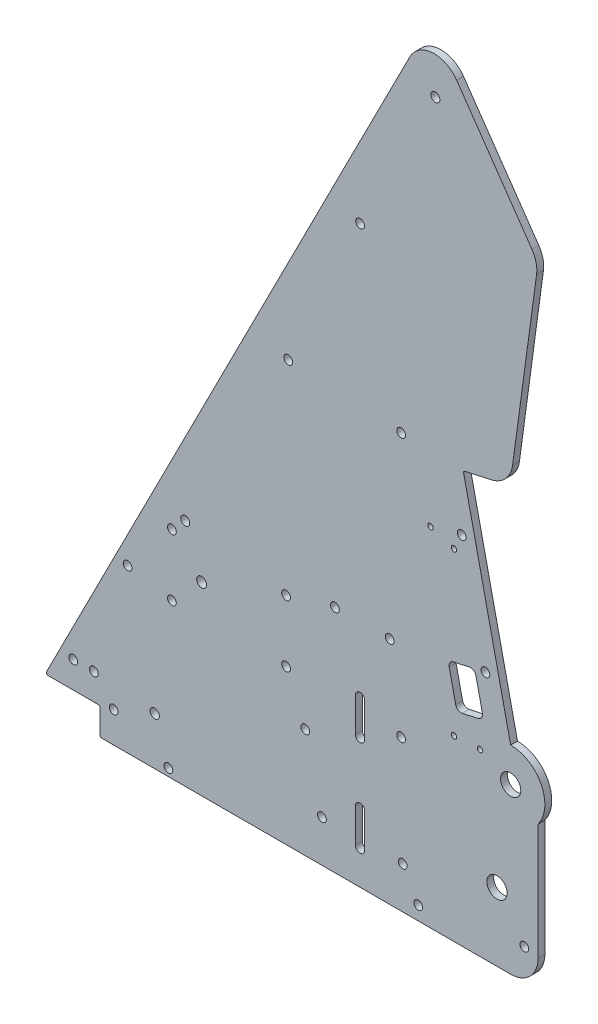
from build123d import *

# Parameters (mm, degrees)
BOSS_EXTRUDE1_DEPTH     = 3.175
SKETCH2_R               = 2.0955
SKETCH2_R_2             = 2.286
SKETCH2_R_3             = 2.032
SKETCH2_R_4             = 4.699
CUT_EXTRUDE1_DEPTH      = 421.976111717
SKETCH7_R               = 2.159
CUT_EXTRUDE2_DEPTH      = 421.976111717
CUT_EXTRUDE3_REACH      = 422.976
SKETCH10_R              = 2.032
FILLET1_R               = 12.7
FILLET2_R               = 0.79375
SKETCH12_R              = 2.032
CUT_EXTRUDE5_DEPTH      = 411.989226146
SKETCH13_R              = 2.032
CUT_EXTRUDE6_DEPTH      = 411.989226146
CUT_EXTRUDE7_DEPTH      = 411.989226146
CUT_EXTRUDE7_DEPTH_BACK = 411.989226146
SKETCH14_R              = 1.27
SKETCH14_R_2            = 2.032
FILLET3_R               = 2.54


with BuildPart() as part:
    # Sketch1 → Boss-Extrude1 (new body)
    with BuildSketch(Plane.XY):
        with BuildLine():
            Line((228.6, -12.7), (228.6, 53.975))
            ThreePointArc((228.6, 53.975), (230.099031657, 70.599515829), (215.9, 79.375))
            Line((215.9, 79.375), (193.909735224, 178.566674323))
            Line((193.909735224, 178.566674323), (215.607913982, 183.377044743))
            Line((215.607913982, 183.377044743), (228.6, 279.4))
            Line((228.6, 279.4), (178.754725958, 351.413083686))
            Line((178.754725958, 351.413083686), (0, 0))
            Line((0, 0), (25.4, 0))
            Line((25.4, 0), (25.4, -12.7))
            Line((25.4, -12.7), (228.6, -12.7))
        make_face()
    extrude(amount=BOSS_EXTRUDE1_DEPTH)

    # Sketch2 → Cut-Extrude1 (cut, through all)
    with BuildSketch(Plane.XY.offset(3.175)):
        with Locations((64.943150167, 94.057839899)):
            Circle(SKETCH2_R)
        with Locations((180.975, 322.164313376)):
            Circle(SKETCH2_R)
        with Locations((72.544547852, 73.173171402)):
            Circle(SKETCH2_R_2)
        with Locations((193.207821773, 152.394364194)):
            Circle(SKETCH2_R_3)
        with Locations((215.9, 63.5)):
            Circle(SKETCH2_R_4)
        with Locations((173.0375, -6.35)):
            Circle(SKETCH2_R_3)
        with Locations((204.202954161, 102.798527032)):
            Circle(SKETCH2_R_3)
        with Locations((209.55, 19.05)):
            Circle(SKETCH2_R_4)
        with Locations((165.1, 179.3875)):
            Circle(SKETCH2_R_3)
        with Locations((111.724047852, 87.460671402)):
            Circle(SKETCH2_R_3)
        with Locations((111.724047852, 58.885671402)):
            Circle(SKETCH2_R_3)
        with Locations((58.765047852, 58.885671402)):
            Circle(SKETCH2_R_3)
        with Locations((58.765047852, 87.460671402)):
            Circle(SKETCH2_R_3)
    extrude(amount=-CUT_EXTRUDE1_DEPTH, mode=Mode.SUBTRACT)

    # Sketch7 → Cut-Extrude2 (cut, through all)
    with BuildSketch(Plane.XY.offset(3.175)):
        with Locations((50.8, 9.525)):
            Circle(SKETCH7_R)
        with BuildLine():
            Line((143.891, 3.175), (143.891, 19.05))
            ThreePointArc((143.891, 19.05), (146.05, 21.209), (148.209, 19.05))
            Line((148.209, 19.05), (148.209, 3.175))
            ThreePointArc((148.209, 3.175), (146.05, 1.016), (143.891, 3.175))
        make_face()
        with BuildLine():
            Line((143.891, 47.625), (143.891, 63.5))
            ThreePointArc((143.891, 63.5), (146.05, 65.659), (148.209, 63.5))
            Line((148.209, 63.5), (148.209, 47.625))
            ThreePointArc((148.209, 47.625), (146.05, 45.466), (143.891, 47.625))
        make_face()
    extrude(amount=-CUT_EXTRUDE2_DEPTH, mode=Mode.SUBTRACT)

    # Sketch10 → Cut-Extrude3 (cut, up to next)
    with BuildSketch(Plane.XY.offset(3.175), mode=Mode.PRIVATE) as cut_extrude3_sk1:
        with Locations((120.65, 38.1)):
            Circle(SKETCH10_R)
    cut_extrude3_tool1 = extrude(cut_extrude3_sk1.sketch, amount=-CUT_EXTRUDE3_REACH, mode=Mode.PRIVATE) & part.part
    # Sketch10 → Cut-Extrude3 (cut, up to next)
    with BuildSketch(Plane.XY.offset(3.175), mode=Mode.PRIVATE) as cut_extrude3_sk2:
        with Locations((165.1, 57.15)):
            Circle(SKETCH10_R)
    cut_extrude3_tool2 = extrude(cut_extrude3_sk2.sketch, amount=-CUT_EXTRUDE3_REACH, mode=Mode.PRIVATE) & part.part
    # Sketch10 → Cut-Extrude3 (cut, up to next)
    with BuildSketch(Plane.XY.offset(3.175), mode=Mode.PRIVATE) as cut_extrude3_sk3:
        with Locations((13.046467246, 12.334704411)):
            Circle(SKETCH10_R)
    cut_extrude3_tool3 = extrude(cut_extrude3_sk3.sketch, amount=-CUT_EXTRUDE3_REACH, mode=Mode.PRIVATE) & part.part
    # Sketch10 → Cut-Extrude3 (cut, up to next)
    with BuildSketch(Plane.XY.offset(3.175), mode=Mode.PRIVATE) as cut_extrude3_sk4:
        with Locations((22.571467246, 12.334704411)):
            Circle(SKETCH10_R)
    cut_extrude3_tool4 = extrude(cut_extrude3_sk4.sketch, amount=-CUT_EXTRUDE3_REACH, mode=Mode.PRIVATE) & part.part
    # Sketch10 → Cut-Extrude3 (cut, up to next)
    with BuildSketch(Plane.XY.offset(3.175), mode=Mode.PRIVATE) as cut_extrude3_sk5:
        with Locations((38.211447917, 62.639810909)):
            Circle(SKETCH10_R)
    cut_extrude3_tool5 = extrude(cut_extrude3_sk5.sketch, amount=-CUT_EXTRUDE3_REACH, mode=Mode.PRIVATE) & part.part
    add(cut_extrude3_tool1.solids().sort_by_distance((120.65, 38.1, 3.175))[0], mode=Mode.SUBTRACT)
    add(cut_extrude3_tool2.solids().sort_by_distance((165.1, 57.15, 3.175))[0], mode=Mode.SUBTRACT)
    add(cut_extrude3_tool3.solids().sort_by_distance((13.046467, 12.334704, 3.175))[0], mode=Mode.SUBTRACT)
    add(cut_extrude3_tool4.solids().sort_by_distance((22.571467, 12.334704, 3.175))[0], mode=Mode.SUBTRACT)
    add(cut_extrude3_tool5.solids().sort_by_distance((38.211448, 62.639811, 3.175))[0], mode=Mode.SUBTRACT)

    # Fillet1
    fillet1_edges = [part.edges().sort_by_distance(p)[0] for p in [
        (228.6, -12.7, 1.5875),
        (178.754725958, 351.413083686, 1.5875),
        (215.607913982, 183.377044743, 1.5875),
        (228.6, 279.4, 1.5875),
    ]]
    fillet(fillet1_edges, radius=FILLET1_R)

    # Fillet2
    fillet2_edges = [part.edges().sort_by_distance(p)[0] for p in [
        (25.4, -12.7, 1.5875),
        (25.4, 0, 1.5875),
        (193.909735224, 178.566674323, 1.5875),
        (0, 0, 1.5875),
    ]]
    fillet(fillet2_edges, radius=FILLET2_R)

    # Sketch12 → Cut-Extrude5 (cut, through all)
    with BuildSketch(Plane.XY.offset(3.175)):
        with Locations((31.75, 1.5875)):
            Circle(SKETCH12_R)
        with Locations((173.0375, -6.35)):
            Circle(SKETCH12_R)
        with Locations((222.25, 1.5875)):
            Circle(SKETCH12_R)
        with Locations((57.15, -9.2075)):
            Circle(SKETCH12_R)
    extrude(amount=-CUT_EXTRUDE5_DEPTH, mode=Mode.SUBTRACT)

    # Sketch13 → Cut-Extrude6 (cut, through all)
    with BuildSketch(Plane.XY.offset(3.175)):
        with Locations((112.7125, 182.5625)):
            Circle(SKETCH13_R)
        with Locations((146.05, 254)):
            Circle(SKETCH13_R)
    extrude(amount=-CUT_EXTRUDE6_DEPTH, mode=Mode.SUBTRACT)

    # Sketch14 → Cut-Extrude7 (cut, two sides: drawn at the far end of the back side and taken through both)
    with BuildSketch(Plane.XY.offset(3.175).offset(-CUT_EXTRUDE7_DEPTH_BACK)):
        with Locations((189.602197334, 69.980636704)):
            Circle(SKETCH14_R)
        with Locations((201.708862449, 70.509225118)):
            Circle(SKETCH14_R)
        with Locations((159.793547852, 93.98)):
            Circle(SKETCH14_R_2)
        with Locations((134.393547852, 93.98)):
            Circle(SKETCH14_R_2)
        with Locations((178.721644858, 148.532438598)):
            Circle(SKETCH14_R)
        with Locations((189.622629605, 145.09537131)):
            Circle(SKETCH14_R)
        with Locations((128.361047852, 6.6675)):
            Circle(SKETCH14_R_2)
        with Locations((165.826047852, 6.6675)):
            Circle(SKETCH14_R_2)
        Polygon((186.844411154, 98.950230697), (199.243370445, 101.699013794), (203.36654509, 83.100574858), (190.9675858, 80.351791761), align=None)
    extrude(amount=CUT_EXTRUDE7_DEPTH + CUT_EXTRUDE7_DEPTH_BACK, mode=Mode.SUBTRACT)

    # Fillet3
    fillet3_edges = [part.edges().sort_by_distance(p)[0] for p in [
        (199.243370445, 101.699013794, 1.5875),
        (186.844411154, 98.950230697, 1.5875),
        (190.9675858, 80.351791761, 1.5875),
        (203.36654509, 83.100574858, 1.5875),
    ]]
    fillet(fillet3_edges, radius=FILLET3_R)


solid = part.part
